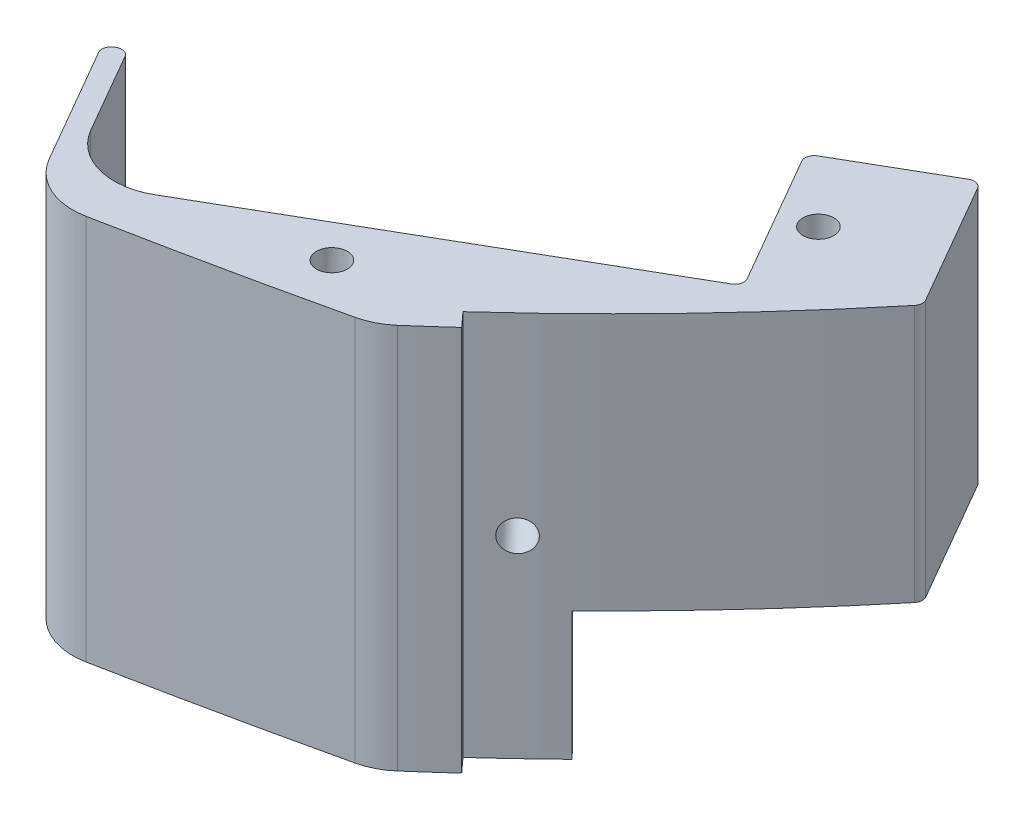
from build123d import *
from build123d.topology import SkipClean

# Parameters (mm, degrees)
ESQUISSE1_R                     = 1.2
BOSS_EXTRU_1_DEPTH              = 20
ENL_V_MAT_EXTRU_1_DEPTH         = 193.532860321
DIAM_TRE_DU_PER_AGE_2_4_2_4_1_D = 2.4
EXTRU_MINCE1_DEPTH              = 10
ENL_V_MAT_EXTRU_2_DEPTH         = 10
CONG_1_R                        = 0.7
CONG_2_R                        = 5


with BuildPart() as part:
    # Esquisse1 → Boss.-Extru.1 (new body)
    with BuildSketch(Plane(origin=(0, 0, 0), x_dir=(1, 0, 0), z_dir=(0, 1, 0))):
        with BuildLine():
            Line((84.027568136, -123.770834875), (92.687822174, -118.770834875))
            Line((92.687822174, -118.770834875), (99.187822174, -130.029165125))
            Line((99.187822174, -130.029165125), (125.168584287, -115.029165125))
            Line((125.168584287, -115.029165125), (118.668584287, -103.770834875))
            Line((118.668584287, -103.770834875), (127.328838325, -98.770834875))
            Line((127.328838325, -98.770834875), (134.227704746, -110.720022031))
            ThreePointArc((134.227704746, -110.720022031), (124.269465579, -121.791214481), (113.401091599, -131.970422535))
            ThreePointArc((113.401091599, -131.970422535), (102.435456053, -134.394500729), (91.418143327, -136.571686604))
            Line((91.418143327, -136.571686604), (84.027568136, -123.770834875))
        make_face()
        with Locations(Location((93.772758664, -125.65, 0), (0, 0, 270))):
            Circle(ESQUISSE1_R, mode=Mode.SUBTRACT)
        with Locations(Location((124.083647797, -108.15, 0), (0, 0, 90))):
            Circle(ESQUISSE1_R, mode=Mode.SUBTRACT)
        with Locations(Location((107.433012702, -129.310254038, 0), (0, 0, 270))):
            Circle(ESQUISSE1_R, mode=Mode.SUBTRACT)
    extrude(amount=BOSS_EXTRU_1_DEPTH)

    # Esquisse2 → Enlèv. mat.-Extru.1 (cut, through all)
    with BuildSketch(Plane(origin=(0, 20, 0), x_dir=(1, 0, 0), z_dir=(0, 1, 0))):
        with BuildLine():
            Line((115.99137931, -127.680264433), (117, -128.790527602))
            ThreePointArc((117, -128.790527602), (125.938380571, -120.064667155), (134.227704746, -110.720022031))
            Line((134.227704746, -110.720022031), (133.426606, -109.332478301))
            ThreePointArc((133.426606, -109.332478301), (125.045964201, -118.82658304), (115.99137931, -127.680264433))
        make_face()
    extrude(amount=-ENL_V_MAT_EXTRU_1_DEPTH, mode=Mode.SUBTRACT)

    # Diamètre du perçage Ø2.4 (2.4)1 (through all)
    with Locations(Plane(origin=(118.194280465, 5, 125.643790397), x_dir=(0.728369799401, 0, -0.685184234583), z_dir=(0.685184234583, 0, 0.728369799401))):
        with Locations((1e-09, 0)):
            Hole(DIAM_TRE_DU_PER_AGE_2_4_2_4_1_D / 2)

    # Esquisse4 → Extru.-Mince1 (add)
    with SkipClean():  # the faces are left unmerged after this step: merging them gives an invalid solid
        with BuildSketch(Plane.XZ):
            with BuildLine():
                Line((84.027568136, 123.770834875), (91.418143327, 136.571686604))
                ThreePointArc((91.418143327, 136.571686604), (102.435456053, 134.394500729), (113.401091599, 131.970422535))
                ThreePointArc((113.401091599, 131.970422535), (115.211517156, 130.392892117), (117, 128.790527602))
                Line((117, 128.790527602), (115.99137931, 127.680264433))
                ThreePointArc((115.99137931, 127.680264433), (118.194363092, 125.643712669), (120.361595403, 123.569156152))
                Line((120.361595403, 123.569156152), (119.314972834, 122.49464175))
                ThreePointArc((119.314972834, 122.49464175), (116.61917678, 125.063854119), (113.868071592, 127.573752285))
                Line((113.868071592, 127.573752285), (114.876730751, 128.6840578))
                ThreePointArc((114.876730751, 128.6840578), (113.79334288, 129.643068138), (112.701949349, 130.592957746))
                ThreePointArc((112.701949349, 130.592957746), (102.466724149, 132.855327369), (92.1861921, 134.901986101))
                Line((92.1861921, 134.901986101), (85.326606241, 123.020834875))
                Line((85.326606241, 123.020834875), (84.027568136, 123.770834875))
            make_face()
        extrude(amount=EXTRU_MINCE1_DEPTH)

    # Esquisse5 → Enlèv. mat.-Extru.2 (cut)
    with SkipClean():  # the faces are left unmerged after this step: merging them gives an invalid solid
        with BuildSketch(Plane(origin=(0, 20, 0), x_dir=(1, 0, 0), z_dir=(0, 1, 0))):
            Polygon((112.17820323, -122.529165125), (91.826606241, -134.279165125), (85.326606241, -123.020834875), (105.67820323, -111.270834875), align=None)
        extrude(amount=-ENL_V_MAT_EXTRU_2_DEPTH, mode=Mode.SUBTRACT)

    # Congé1
    # the kernel refuses this fillet: 0.7 mm, written as the material it adds along each edge
    with BuildSketch(Plane(origin=(125.168584287, 0, 115.029165125), x_dir=(-0.5000000000000003, 0, -0.8660254037844384), z_dir=(0, 1, 0))) as cong_1_piece_1:
        with BuildLine():
            CenterArc((CONG_1_R, CONG_1_R), CONG_1_R, 180, 90)
            Line((0, CONG_1_R), (0, 0))
            Line((0, 0), (CONG_1_R, 0))
        make_face()
    extrude(amount=20)
    with BuildSketch(Plane(origin=(99.187822174, 0, 130.029165125), x_dir=(-0.5000000000000068, 0, -0.8660254037844347), z_dir=(0, 1, 0))) as cong_1_piece_2:
        with BuildLine():
            CenterArc((CONG_1_R, -CONG_1_R), CONG_1_R, 90, 90)
            Line((0, -CONG_1_R), (0, 0))
            Line((0, 0), (CONG_1_R, 0))
        make_face()
    extrude(amount=10)
    with BuildSketch(Plane(origin=(114.876730751, 1.772512212, 128.6840578), x_dir=(-0.7473615518357495, 0, 0.6644175726436354), z_dir=(0, -1, 0))) as cong_1_piece_3:
        with BuildLine():
            CenterArc((0.707566324, 0.699998522), CONG_1_R, 179.384021678, 90.733726194)
            Line((0.007606777, 0.707523972), (0, 0))
            ThreePointArc((0, 0), (0.354502442, -0.000364267), (0.709004885, 0))
        make_face()
    extrude(amount=11.772512212)
    # the kernel refuses this fillet: 0.7 mm, written as the material it takes off along each edge
    with BuildSketch(Plane(origin=(85.326606241, 0, 123.020834875), x_dir=(-0.8660254037844296, 0, 0.5000000000000155), z_dir=(0, -1, 0)), Plane(origin=(85.326606241, 21.75, 123.020834875), x_dir=(-0.8660254037844347, 0, 0.5000000000000068), z_dir=(0, -1, 0)), Plane(origin=(84.027568136, 0, 123.770834875), x_dir=(0.5000000000000003, 0, 0.8660254037844384), z_dir=(0, -1, 0))) as cong_1_2_piece_1:
        with BuildLine():
            CenterArc((CONG_1_R, -CONG_1_R), CONG_1_R, 90, 90)
            Line((0, -CONG_1_R), (0, 0))
            Line((0, 0), (CONG_1_R, 0))
        make_face()
    extrude(amount=11.75, mode=Mode.SUBTRACT)
    with BuildSketch(Plane(origin=(84.027568136, 0, 123.770834875), x_dir=(0.5000000000000003, 0, 0.8660254037844384), z_dir=(0, 1, 0))) as cong_1_2_piece_2:
        with BuildLine():
            CenterArc((CONG_1_R, CONG_1_R), CONG_1_R, 180, 90)
            Line((0, CONG_1_R), (0, 0))
            Line((0, 0), (CONG_1_R, 0))
        make_face()
    extrude(amount=21.75, mode=Mode.SUBTRACT)
    with BuildSketch(Plane(origin=(127.328838325, -1.75, 98.770834875), x_dir=(0.499999999999998, 0, 0.8660254037844398), z_dir=(0, 1, 0)), Plane(origin=(118.668584287, -1.75, 103.770834875), x_dir=(0.8660254037844384, 0, -0.5000000000000003), z_dir=(0, 1, 0))) as cong_1_2_piece_3:
        with BuildLine():
            CenterArc((CONG_1_R, -CONG_1_R), CONG_1_R, 90, 90)
            Line((0, -CONG_1_R), (0, 0))
            Line((0, 0), (CONG_1_R, 0))
        make_face()
    extrude(amount=23.5, mode=Mode.SUBTRACT)
    with BuildSketch(Plane(origin=(133.426606, 21.214506308, 109.332478301), x_dir=(-0.6349000058831564, 0, 0.7725943195038182), z_dir=(0, -1, 0))) as cong_1_2_piece_4:
        with BuildLine():
            CenterArc((0.484816837, 0.699999306), CONG_1_R, 200.587431515, 69.493248031)
            Line((-0.170478849, 0.453853893), (0, 0))
            ThreePointArc((0, 0), (0.242901262, -0.000171018), (0.485802523, 0))
        make_face()
    extrude(amount=22.429012616, mode=Mode.SUBTRACT)
    with BuildSketch(Plane(origin=(92.687822174, -1.75, 118.770834875), x_dir=(-0.8660254037844347, 0, 0.5000000000000068), z_dir=(0, 1, 0))) as cong_1_2_piece_5:
        with BuildLine():
            CenterArc((CONG_1_R, CONG_1_R), CONG_1_R, 180, 90)
            Line((0, CONG_1_R), (0, 0))
            Line((0, 0), (CONG_1_R, 0))
        make_face()
    extrude(amount=13.5, mode=Mode.SUBTRACT)
    with BuildSketch(Plane(origin=(119.314972834, 0, 122.49464175), x_dir=(-0.7177637664774796, 0, 0.6962867049801125), z_dir=(0, -1, 0))) as cong_1_2_piece_6:
        with BuildLine():
            CenterArc((0.698574544, -0.699998546), CONG_1_R, 90.116794283, 89.766411434)
            Line((-0.001424002, -0.698571635), (0, 0))
            ThreePointArc((0, 0), (0.348573817, -0.000355274), (0.697147634, 0))
        make_face()
    extrude(amount=11.746432717, mode=Mode.SUBTRACT)
    with BuildSketch(Plane(origin=(113.868071592, 0, 127.573752285), x_dir=(0.6724137931033691, 0, 0.7401754459885436), z_dir=(0, -1, 0))) as cong_1_2_piece_7:
        with BuildLine():
            CenterArc((0.704715348, -0.7), CONG_1_R, 90, 90.266958587)
            ThreePointArc((0.004722946, -0.703261503), (0.002723014, -0.351628323), (0, 0))
            Line((0, 0), (0.704715348, 0))
        make_face()
    extrude(amount=11.76178837, mode=Mode.SUBTRACT)

    # Congé2
    # the kernel refuses this fillet: 5 mm, written as the material it adds along each edge
    with BuildSketch(Plane(origin=(92.1861921, 8.938383059, 134.901986101), x_dir=(0.9820827402296215, 0, -0.18845023572040911), z_dir=(0, -1, 0))) as cong_2_piece_1:
        with BuildLine():
            CenterArc((3.557422666, -4.999967849), CONG_2_R, 89.794530502, 71.067825025)
            Line((-1.166245932, -3.360774456), (0, 0))
            ThreePointArc((0, 0), (1.787676612, 0.003205414), (3.575353224, 0))
        make_face()
    extrude(amount=18.938383059)
    with BuildSketch(Plane(origin=(112.701949349, 3.163738142, 130.592957746), x_dir=(0.7546589965998223, 0, -0.6561172142620169), z_dir=(0, -1, 0))) as cong_2_piece_2:
        with BuildLine():
            CenterArc((1.247154746, -4.999966362), CONG_2_R, 89.789832754, 28.292116565)
            ThreePointArc((-1.106515, -0.588590304), (-0.553442478, -0.293947404), (0, 0))
            ThreePointArc((0, 0), (0.632747628, 0.001160495), (1.265495257, 0))
        make_face()
    extrude(amount=13.163738142)
    with BuildSketch(Plane(origin=(91.826606241, 20, 134.279165125), x_dir=(0.866025403784453, 0, -0.49999999999997513), z_dir=(0, -1, 0))) as cong_2_piece_3:
        with BuildLine():
            CenterArc((CONG_2_R, -CONG_2_R), CONG_2_R, 90, 90)
            Line((0, -CONG_2_R), (0, 0))
            Line((0, 0), (CONG_2_R, 0))
        make_face()
    extrude(amount=10)
    # the kernel refuses this fillet: 5 mm, written as the material it takes off along each edge
    with BuildSketch(Plane(origin=(113.401091599, -13.143565693, 131.970422535), x_dir=(0.7560908595637044, 1.2400707538838124e-15, -0.6544666623168968), z_dir=(0, 1, 0))) as cong_2_2_piece_1:
        with BuildLine():
            CenterArc((1.239359808, 4.99996736), CONG_2_R, 242.086933336, 28.120093605)
            ThreePointArc((-1.101296945, 0.581672896), (-0.550829587, 0.29049354), (0, 0))
            ThreePointArc((0, 0), (0.628713139, -0.001135866), (1.257426277, 0))
        make_face()
    extrude(amount=36.287131385, mode=Mode.SUBTRACT)
    with BuildSketch(Plane(origin=(91.418143327, -18.917959017, 136.571686604), x_dir=(0.9824849074326925, 0, -0.18634217629665503), z_dir=(0, 1, 0))) as cong_2_2_piece_2:
        with BuildLine():
            CenterArc((3.549347689, 4.999968188), CONG_2_R, 199.260605737, 70.943779261)
            Line((-1.170792196, 3.350641212), (0, 0))
            ThreePointArc((0, 0), (1.783591803, -0.00318121), (3.567183607, 0))
        make_face()
    extrude(amount=47.835918033, mode=Mode.SUBTRACT)
    with BuildSketch(Plane(origin=(95.545706006, -10, 117.120834875), x_dir=(0.5000000000000072, 0, 0.8660254037844346), z_dir=(-0.8660254037844346, 0, 0.5000000000000071))) as cong_2_2_piece_3:
        with BuildLine():
            CenterArc((CONG_2_R, CONG_2_R), CONG_2_R, 180, 90)
            Line((0, CONG_2_R), (0, 0))
            Line((0, 0), (CONG_2_R, 0))
        make_face()
    extrude(amount=25.1, mode=Mode.SUBTRACT)


solid = part.part
